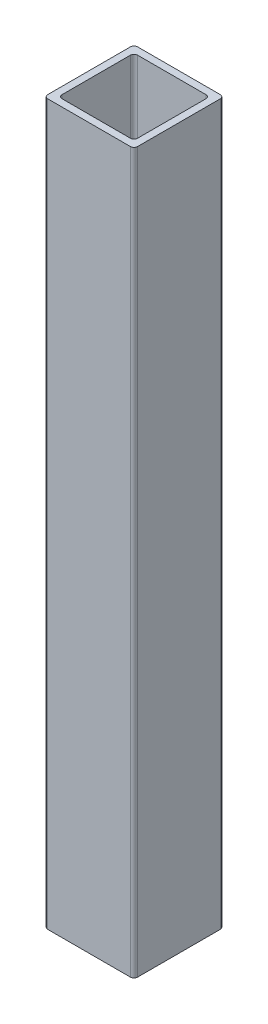
from build123d import *

# Parameters (mm, degrees)
BOSS_EXTRUDE1_DEPTH = 200


with BuildPart() as part:
    # Sketch1 → Boss-Extrude1 (new body)
    with BuildSketch(Plane(origin=(0, 0, 0), x_dir=(1, 0, 0), z_dir=(0, 1, 0))):
        with BuildLine():
            Line((-11.5, -12.5), (11.5, -12.5))
            ThreePointArc((11.5, -12.5), (12.207106781, -12.207106781), (12.5, -11.5))
            Line((12.5, -11.5), (12.5, 11.5))
            ThreePointArc((12.5, 11.5), (12.207106781, 12.207106781), (11.5, 12.5))
            Line((11.5, 12.5), (-11.5, 12.5))
            ThreePointArc((-11.5, 12.5), (-12.207106781, 12.207106781), (-12.5, 11.5))
            Line((-12.5, 11.5), (-12.5, -11.5))
            ThreePointArc((-12.5, -11.5), (-12.207106781, -12.207106781), (-11.5, -12.5))
        make_face()
        with BuildLine():
            Line((-9.5, -10.5), (9.5, -10.5))
            ThreePointArc((9.5, -10.5), (10.207106781, -10.207106781), (10.5, -9.5))
            Line((10.5, -9.5), (10.5, 9.5))
            ThreePointArc((10.5, 9.5), (10.207106781, 10.207106781), (9.5, 10.5))
            Line((9.5, 10.5), (-9.5, 10.5))
            ThreePointArc((-9.5, 10.5), (-10.207106781, 10.207106781), (-10.5, 9.5))
            Line((-10.5, 9.5), (-10.5, -9.5))
            ThreePointArc((-10.5, -9.5), (-10.207106781, -10.207106781), (-9.5, -10.5))
        make_face(mode=Mode.SUBTRACT)
    extrude(amount=BOSS_EXTRUDE1_DEPTH)


solid = part.part
